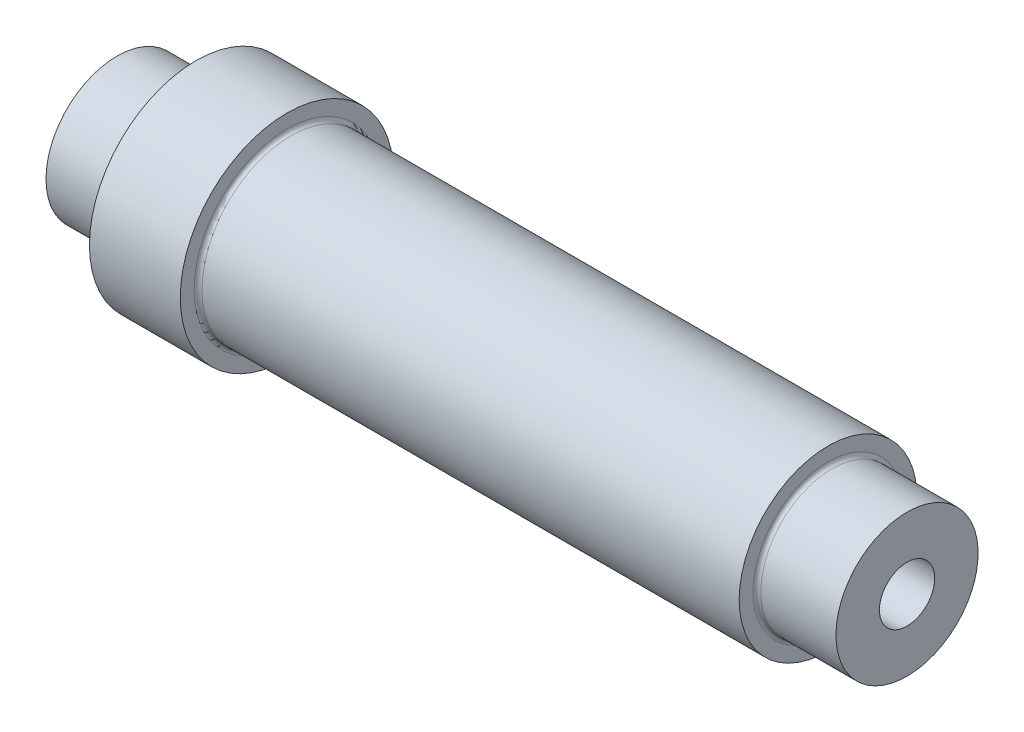
from build123d import *

# Parameters (mm, degrees)
BROCA_DE_ROSQUEAR_PARA_TARRAXA_DE_M161_D       = 14
BROCA_DE_ROSQUEAR_PARA_TARRAXA_DE_M161_DEPTH   = 30
BROCA_DE_ROSQUEAR_PARA_TARRAXA_DE_M161_TIP     = 4.206024333
BROCA_DE_ROSQUEAR_PARA_TARRAXA_DE_M161_O_D     = 14
BROCA_DE_ROSQUEAR_PARA_TARRAXA_DE_M161_O_DEPTH = 30
BROCA_DE_ROSQUEAR_PARA_TARRAXA_DE_M161_O_TIP   = 4.206024333
FILETE1_R                                      = 1


with BuildPart() as part:
    # Esboço1 → Revolução1 (revolve)
    with BuildSketch(Plane.XY):
        Polygon((0, 0), (0, 18), (20, 18), (20, 27), (43, 27), (43, 22.5), (180, 22.5), (180, 18), (200, 18), (200, 0), align=None)
    revolve(axis=Axis((0, 0, 0), (1, 0, 0)))

    # Broca de rosquear para tarraxa de M161
    with Locations(Plane(origin=(200, 0, 0), x_dir=(0, 0, 1), z_dir=(1, 0, 0))):
        with Locations((0, 0)):
            Hole(BROCA_DE_ROSQUEAR_PARA_TARRAXA_DE_M161_D / 2, depth=BROCA_DE_ROSQUEAR_PARA_TARRAXA_DE_M161_DEPTH)
            with Locations((0, 0, -(BROCA_DE_ROSQUEAR_PARA_TARRAXA_DE_M161_DEPTH + BROCA_DE_ROSQUEAR_PARA_TARRAXA_DE_M161_TIP / 2))):  # 118° drill point
                Cone(0, BROCA_DE_ROSQUEAR_PARA_TARRAXA_DE_M161_D / 2, BROCA_DE_ROSQUEAR_PARA_TARRAXA_DE_M161_TIP, mode=Mode.SUBTRACT)

    # Broca de rosquear para tarraxa de M161 o
    with Locations(Plane(origin=(0, 0, 0), x_dir=(0, 0, -1), z_dir=(-1, 0, 0))):
        with Locations((0, 0)):
            Hole(BROCA_DE_ROSQUEAR_PARA_TARRAXA_DE_M161_O_D / 2, depth=BROCA_DE_ROSQUEAR_PARA_TARRAXA_DE_M161_O_DEPTH)
            with Locations((0, 0, -(BROCA_DE_ROSQUEAR_PARA_TARRAXA_DE_M161_O_DEPTH + BROCA_DE_ROSQUEAR_PARA_TARRAXA_DE_M161_O_TIP / 2))):  # 118° drill point
                Cone(0, BROCA_DE_ROSQUEAR_PARA_TARRAXA_DE_M161_O_D / 2, BROCA_DE_ROSQUEAR_PARA_TARRAXA_DE_M161_O_TIP, mode=Mode.SUBTRACT)

    # Filete1
    filete1_edges = [part.edges().sort_by_distance(p)[0] for p in [
        (20, -18, 0),
        (180, -18, 0),
        (43, -22.5, 0),
    ]]
    fillet(filete1_edges, radius=FILETE1_R)


solid = part.part
